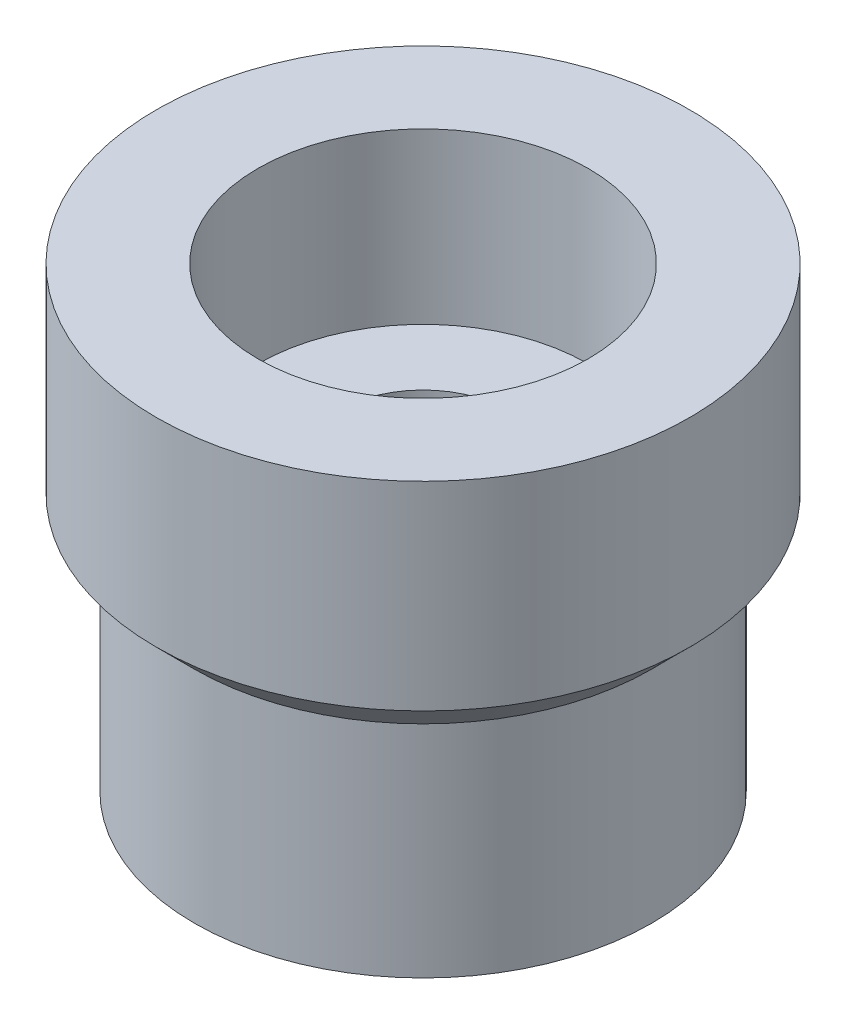
from build123d import *

# Parameters (mm, degrees)
SKETCH_1_R      = 2.7
SKETCH_1_R_2    = 1.5
EXTRUDE_1_DEPTH = 2.6
SKETCH_2_R      = 2.7
SKETCH_2_R_2    = 1
EXTRUDE_2_DEPTH = 0.8
SKETCH_3_R      = 3.15
SKETCH_3_R_2    = 1.95
EXTRUDE_3_DEPTH = 2
CHAMFER_1_SIZE  = 0.8


with BuildPart() as part:
    # Эскиз1 → Бобышка-Вытянуть1 (new body)
    with BuildSketch(Plane(origin=(0, 0, 0), x_dir=(1, 0, 0), z_dir=(0, 1, 0))):
        with Locations(Location((0, 0, 0), (0, 0, 270))):
            Circle(SKETCH_1_R)
        with Locations(Location((0, 0, 0), (0, 0, 270))):
            Circle(SKETCH_1_R_2, mode=Mode.SUBTRACT)
    extrude(amount=EXTRUDE_1_DEPTH)

    # Эскиз2 → Бобышка-Вытянуть2 (add)
    with BuildSketch(Plane(origin=(0, 2.6, 0), x_dir=(1, 0, 0), z_dir=(0, 1, 0))):
        with Locations(Location((0, 0, 0), (0, 0, 270))):
            Circle(SKETCH_2_R)
        with Locations(Location((0, 0, 0), (0, 0, 270))):
            Circle(SKETCH_2_R_2, mode=Mode.SUBTRACT)
    extrude(amount=EXTRUDE_2_DEPTH)

    # Эскиз3 → Бобышка-Вытянуть3 (add)
    with BuildSketch(Plane(origin=(0, 3.4, 0), x_dir=(1, 0, 0), z_dir=(0, 1, 0))):
        with Locations(Location((0, 0, 0), (0, 0, 270))):
            Circle(SKETCH_3_R)
        with Locations(Location((0, 0, 0), (0, 0, 270))):
            Circle(SKETCH_3_R_2, mode=Mode.SUBTRACT)
    extrude(amount=EXTRUDE_3_DEPTH)

    # Фаска1
    # the kernel refuses this chamfer: 0.8 mm, written as the material it adds along each edge
    with BuildSketch(Plane(origin=(0, 3.4, 0), x_dir=(0, 0, 1), z_dir=(-1, 0, 0))) as chamfer_1_piece_1_section:
        Polygon((2.7, -CHAMFER_1_SIZE), (2.7 + CHAMFER_1_SIZE, 0), (2.7, 0), align=None)
    chamfer_1_piece_1 = revolve(axis=Axis((0, 3.4, 0), (0, 1, 0)), mode=Mode.PRIVATE)
    chamfer_1_piece_1 = chamfer_1_piece_1 & Plane(origin=(0, 2.825856837, 0), x_dir=(0, 0, 1), z_dir=(0, -1, 0)) * Cylinder(3.15, 14, mode=Mode.PRIVATE)
    add(chamfer_1_piece_1)


solid = part.part
